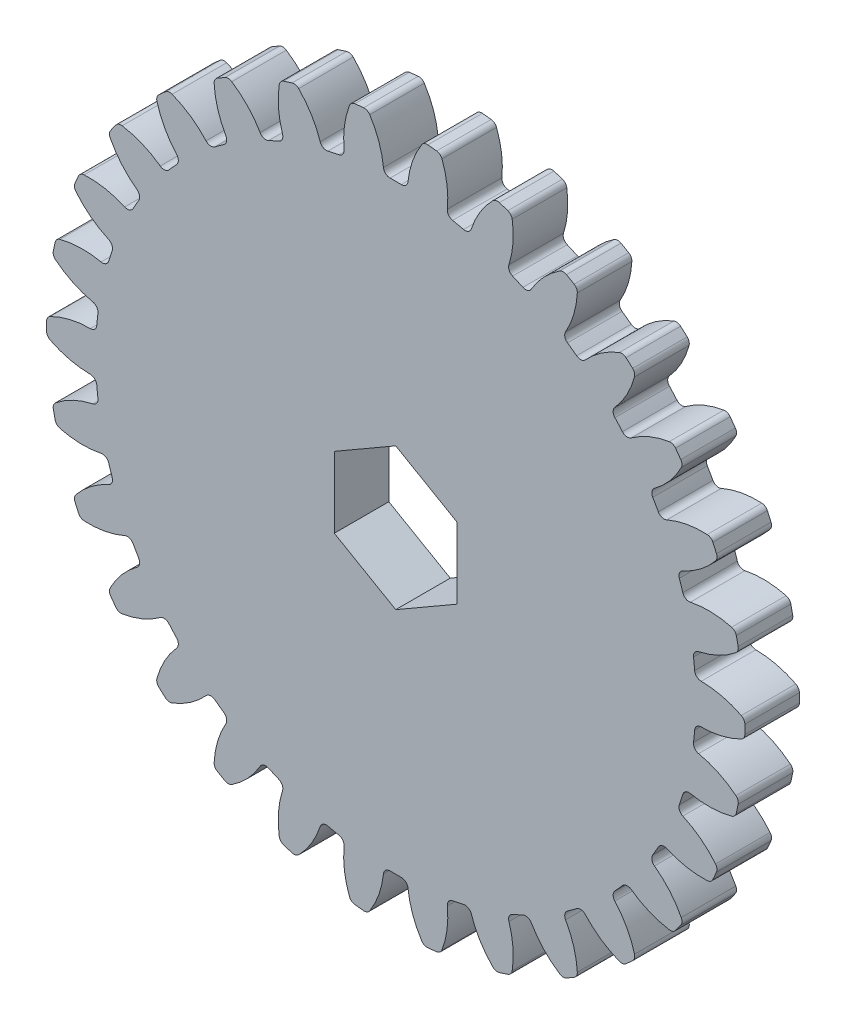
from build123d import *

# Parameters (mm, degrees)
SKETCH1_R                = 32
BOSS_EXTRUDE1_DEPTH      = 2.5
CUT_EXTRUDE1_DEPTH       = 46.530209751
FILLET1_R                = 0.6
CIRPATTERN1_COUNT        = 30
FILLET1_OF_CIRPATTERN1_R = 0.6
SKETCH23_R               = 3.25
CUT_EXTRUDE9_DEPTH       = 0.7
SKETCH24_R               = 4
CUT_EXTRUDE10_DEPTH      = 10
SKETCH25_R               = 4.603821227
BOSS_EXTRUDE2_DEPTH      = 5
SKETCH26_R               = 2.8
CUT_EXTRUDE11_DEPTH      = 10
CUT_EXTRUDE12_DEPTH      = 10


with BuildPart() as part:
    # Sketch1 → Boss-Extrude1 (new, symmetric)
    with BuildSketch(Plane.XY):
        Circle(SKETCH1_R)
    extrude(amount=BOSS_EXTRUDE1_DEPTH, both=True)

    # Sketch3 → Cut-Extrude1 (cut, symmetric)
    with BuildSketch(Plane.XY.offset(2.5)):
        with BuildLine():
            ThreePointArc((-3.356755572, 32.828831719), (-1.729097415, 30.362249055), (-1.082239285, 27.478696442))
            ThreePointArc((-1.082239285, 27.478696442), (0, 27.5), (1.082239285, 27.478696442))
            ThreePointArc((1.082239285, 27.478696442), (1.729097415, 30.362249055), (3.356755572, 32.828831719))
            ThreePointArc((3.356755572, 32.828831719), (0, 33), (-3.356755572, 32.828831719))
        make_face()
    cut_extrude1 = extrude(amount=CUT_EXTRUDE1_DEPTH, both=True, mode=Mode.SUBTRACT)

    # Fillet1
    fillet1_edges = [part.edges().sort_by_distance(p)[0] for p in [
        (-2.585339624, 31.895391815, 0),
        (-1.082239285, 27.478696442, 0),
        (1.082239285, 27.478696442, 0),
        (2.585339624, 31.895391815, 0),
    ]]
    fillet(fillet1_edges, radius=FILLET1_R)

    # CirPattern1: Cut-Extrude1 ×30 about axis
    cirpattern1_axis = Axis((0, 0, 0), (0, 0, 1))
    for i in range(1, CIRPATTERN1_COUNT):
        add(cut_extrude1.rotate(cirpattern1_axis, i * 360 / CIRPATTERN1_COUNT), mode=Mode.SUBTRACT)

    # Fillet1 of CirPattern1
    fillet1_of_cirpattern1_edges = [part.edges().sort_by_distance(p)[0] for p in [
        (-9.160268592, 30.660878646, 0),
        (-6.771731999, 26.653210796, 0),
        (-4.654552478, 27.103231195, 0),
        (-4.102581091, 31.735923311, 0),
        (-15.334849866, 28.086337952, 0),
        (-12.16526753, 24.662851942, 0),
        (-10.187917963, 25.54322469, 0),
        (-10.611199326, 30.189442672, 0),
        (-20.839224617, 24.284289517, 0),
        (-17.027122495, 21.594608113, 0),
        (-15.276022547, 22.866856696, 0),
        (-16.656057233, 27.323538524, 0),
        (-25.432825254, 19.420901101, 0),
        (-21.144810501, 17.582576287, 0),
        (-19.696491642, 19.191097337, 0),
        (-21.972965514, 23.263464629, 0),
        (-28.914889387, 13.708726116, 0),
        (-24.338368824, 12.802101507, 0),
        (-23.256129539, 14.676594935, 0),
        (-26.329549763, 18.186665699, 0),
        (-31.133234105, 7.397414017, 0),
        (-26.468223641, 7.462113459, 0),
        (-25.799362979, 9.520654908, 0),
        (-29.535406345, 12.315022209, 0),
        (-31.990907099, 0.762799429, 0),
        (-27.441290077, 1.795995246, 0),
        (-27.215040458, 3.948616577, 0),
        (-31.450423943, 5.905153155, 0),
        (-31.450423943, -5.905153155, 0),
        (-27.215040458, -3.948616577, 0),
        (-27.441290077, -1.795995246, 0),
        (-31.990907099, -0.762799429, 0),
        (-29.535406345, -12.315022209, 0),
        (-25.799362979, -9.520654908, 0),
        (-26.468223641, -7.462113459, 0),
        (-31.133234105, -7.397414017, 0),
        (-26.329549763, -18.186665699, 0),
        (-23.256129539, -14.676594935, 0),
        (-24.338368824, -12.802101507, 0),
        (-28.914889387, -13.708726116, 0),
        (-21.972965514, -23.263464629, 0),
        (-19.696491642, -19.191097337, 0),
        (-21.144810501, -17.582576287, 0),
        (-25.432825254, -19.420901101, 0),
        (-16.656057233, -27.323538524, 0),
        (-15.276022547, -22.866856696, 0),
        (-17.027122495, -21.594608113, 0),
        (-20.839224617, -24.284289517, 0),
        (-10.611199326, -30.189442672, 0),
        (-10.187917963, -25.54322469, 0),
        (-12.16526753, -24.662851942, 0),
        (-15.334849866, -28.086337952, 0),
        (-4.102581091, -31.735923311, 0),
        (-4.654552478, -27.103231195, 0),
        (-6.771731999, -26.653210796, 0),
        (-9.160268592, -30.660878646, 0),
        (2.585339624, -31.895391815, 0),
        (1.082239285, -27.478696442, 0),
        (-1.082239285, -27.478696442, 0),
        (-2.585339624, -31.895391815, 0),
        (9.160268592, -30.660878646, 0),
        (6.771731999, -26.653210796, 0),
        (4.654552478, -27.103231195, 0),
        (4.102581091, -31.735923311, 0),
        (15.334849866, -28.086337952, 0),
        (12.16526753, -24.662851942, 0),
        (10.187917963, -25.54322469, 0),
        (10.611199326, -30.189442672, 0),
        (20.839224617, -24.284289517, 0),
        (17.027122495, -21.594608113, 0),
        (15.276022547, -22.866856696, 0),
        (16.656057233, -27.323538524, 0),
        (25.432825254, -19.420901101, 0),
        (21.144810501, -17.582576287, 0),
        (19.696491642, -19.191097337, 0),
        (21.972965514, -23.263464629, 0),
        (28.914889387, -13.708726116, 0),
        (24.338368824, -12.802101507, 0),
        (23.256129539, -14.676594935, 0),
        (26.329549763, -18.186665699, 0),
        (31.133234105, -7.397414017, 0),
        (26.468223641, -7.462113459, 0),
        (25.799362979, -9.520654908, 0),
        (29.535406345, -12.315022209, 0),
        (31.990907099, -0.762799429, 0),
        (27.441290077, -1.795995246, 0),
        (27.215040458, -3.948616577, 0),
        (31.450423943, -5.905153155, 0),
        (31.450423943, 5.905153155, 0),
        (27.215040458, 3.948616577, 0),
        (27.441290077, 1.795995246, 0),
        (31.990907099, 0.762799429, 0),
        (29.535406345, 12.315022209, 0),
        (25.799362979, 9.520654908, 0),
        (26.468223641, 7.462113459, 0),
        (31.133234105, 7.397414017, 0),
        (26.329549763, 18.186665699, 0),
        (23.256129539, 14.676594935, 0),
        (24.338368824, 12.802101507, 0),
        (28.914889387, 13.708726116, 0),
        (21.972965514, 23.263464629, 0),
        (19.696491642, 19.191097337, 0),
        (21.144810501, 17.582576287, 0),
        (25.432825254, 19.420901101, 0),
        (16.656057233, 27.323538524, 0),
        (15.276022547, 22.866856696, 0),
        (17.027122495, 21.594608113, 0),
        (20.839224617, 24.284289517, 0),
        (10.611199326, 30.189442672, 0),
        (10.187917963, 25.54322469, 0),
        (12.16526753, 24.662851942, 0),
        (15.334849866, 28.086337952, 0),
        (4.102581091, 31.735923311, 0),
        (4.654552478, 27.103231195, 0),
        (6.771731999, 26.653210796, 0),
        (9.160268592, 30.660878646, 0),
    ]]
    fillet(fillet1_of_cirpattern1_edges, radius=FILLET1_OF_CIRPATTERN1_R)

    # Sketch23 → Cut-Extrude9 (cut)
    with BuildSketch(Plane(origin=(0, 0, -2.5), x_dir=(-1, 0, 0), z_dir=(0, 0, -1))):
        Circle(SKETCH23_R)
    extrude(amount=-CUT_EXTRUDE9_DEPTH, mode=Mode.SUBTRACT)

    # Sketch24 → Cut-Extrude10 (cut)
    with BuildSketch(Plane.XY.offset(2.5)):
        Circle(SKETCH24_R)
    extrude(amount=-CUT_EXTRUDE10_DEPTH, mode=Mode.SUBTRACT)

    # Sketch25 → Boss-Extrude2 (add, through all)
    with BuildSketch(Plane.XY.offset(2.5)):
        Circle(SKETCH25_R)
    extrude(amount=-BOSS_EXTRUDE2_DEPTH)

    # Sketch26 → Cut-Extrude11 (cut)
    with BuildSketch(Plane(origin=(0, 0, -2.5), x_dir=(-1, 0, 0), z_dir=(0, 0, -1))):
        Circle(SKETCH26_R)
    extrude(amount=-CUT_EXTRUDE11_DEPTH, mode=Mode.SUBTRACT)

    # Sketch27 → Cut-Extrude12 (cut)
    with BuildSketch(Plane(origin=(0, 0, -2.5), x_dir=(-1, 0, 0), z_dir=(0, 0, -1))):
        Polygon((0, 6.5), (-5.629165125, 3.25), (-5.629165125, -3.25), (0, -6.5), (5.629165125, -3.25), (5.629165125, 3.25), align=None)
    extrude(amount=-CUT_EXTRUDE12_DEPTH, mode=Mode.SUBTRACT)


solid = part.part
